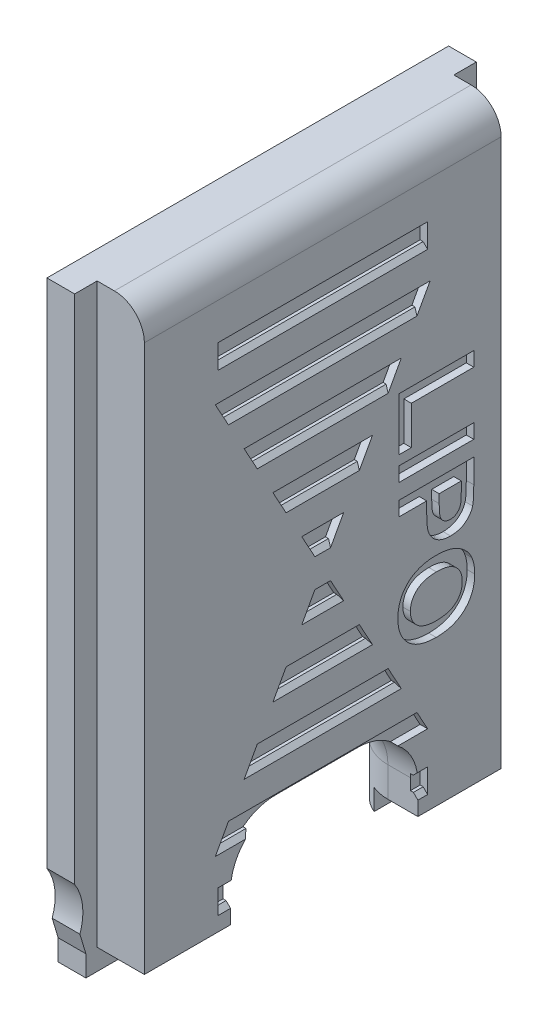
from build123d import *

# Parameters (mm, degrees)
BOSS_EXTRUDE1_DEPTH = 38.5
VARFILLET1_START    = -9.2125
VARFILLET1_DEPTH    = 26.8
CUT_EXTRUDE1_REACH  = 44.621
CUT_EXTRUDE2_REACH  = 44.444
SKETCH5_W           = 1.85
SKETCH5_H           = 6.5
SKETCH5_W_2         = 1.35
SKETCH5_H_2         = 6.3
BOSS_EXTRUDE3_DEPTH = 1.4
SKETCH3_W           = 14
SKETCH3_H           = 1
SKETCH3_W_2         = 5
SKETCH3_H_2         = 0.961538461
CUT_EXTRUDE3_DEPTH  = 0.5
CHAMFER1_SIZE       = 0.3
FILLET1_R           = 3


with BuildPart() as part:
    # Sketch1 → Boss-Extrude1 (new body)
    with BuildSketch(Plane(origin=(0, 0, 0), x_dir=(1, 0, 0), z_dir=(0, 1, 0))):
        Polygon((-3.75, -16.0875), (-3.75, -17.5875), (-5.6, -17.5875), (-5.6, 9.2125), (-3.75, 9.2125), (-3.75, 7.7125), (-0.6, 7.7125), (-0.6, -16.0875), align=None)
    extrude(amount=BOSS_EXTRUDE1_DEPTH)

    # VarFillet1: read off the stored shape, not the designer's step
    # VarFillet1 outline → VarFillet1 (cut)
    with BuildSketch(Plane.XY.offset(VARFILLET1_START)):
        with BuildLine():
            Line((-0.6, 38.5), (-2.6, 38.5))
            add(Edge.make_bspline(
                [(-2.6, 38.5), (-0.6, 38.5), (-0.6, 36.5)],
                knots=[0, 0, 0, 1, 1, 1], degree=2, weights=[1, 0.707106781, 1]))
            Line((-0.6, 36.5), (-0.6, 38.5))
        make_face()
    extrude(amount=VARFILLET1_DEPTH, mode=Mode.SUBTRACT)

    # Sketch2 → Cut-Extrude1 (cut, up to next)
    with BuildSketch(Plane(origin=(-0.6, 0, 0), x_dir=(0, 0, -1), z_dir=(1, 0, 0)), mode=Mode.PRIVATE) as cut_extrude1_sk1:
        with BuildLine():
            Line((-6.8375, 5.5), (-1.3375, 5.5))
            ThreePointArc((-1.3375, 5.5), (1.137373734, 4.474873734), (2.1625, 2))
            Line((2.1625, 2), (2.1625, 0))
            Line((2.1625, 0), (-10.3375, 0))
            Line((-10.3375, 0), (-10.3375, 2))
            ThreePointArc((-10.3375, 2), (-9.312373734, 4.474873734), (-6.8375, 5.5))
        make_face()
    cut_extrude1_tool1 = extrude(cut_extrude1_sk1.sketch, amount=-CUT_EXTRUDE1_REACH, mode=Mode.PRIVATE) & part.part
    add(cut_extrude1_tool1.solids().sort_by_distance((-0.6, 2.587014, 4.0875))[0], mode=Mode.SUBTRACT)

    # Sketch4 → Cut-Extrude2 (cut, up to next)
    with BuildSketch(Plane(origin=(-3.75, 0, 0), x_dir=(0, 0, -1), z_dir=(1, 0, 0)), mode=Mode.PRIVATE) as cut_extrude2_sk1:
        with BuildLine():
            Line((8.4625, 0), (8.8625, 0))
            Line((8.8625, 0), (9.2125, 0))
            Line((9.2125, 0), (9.2125, 4.38348082))
            ThreePointArc((9.2125, 4.38348082), (8.685324623, 2.899063146), (8.8625, 1.333809621))
            Line((8.8625, 1.333809621), (8.4625, 0))
        make_face()
    cut_extrude2_tool1 = extrude(cut_extrude2_sk1.sketch, amount=-CUT_EXTRUDE2_REACH, mode=Mode.PRIVATE) & part.part
    # Sketch4 → Cut-Extrude2 (cut, up to next)
    with BuildSketch(Plane(origin=(-3.75, 0, 0), x_dir=(0, 0, -1), z_dir=(1, 0, 0)), mode=Mode.PRIVATE) as cut_extrude2_sk2:
        with BuildLine():
            Line((-17.5875, 4.38348082), (-17.5875, 0))
            Line((-17.5875, 0), (-17.2375, 0))
            Line((-17.2375, 0), (-16.8375, 0))
            Line((-16.8375, 0), (-17.2375, 1.333809621))
            ThreePointArc((-17.2375, 1.333809621), (-17.060324623, 2.899063146), (-17.5875, 4.38348082))
        make_face()
    cut_extrude2_tool2 = extrude(cut_extrude2_sk2.sketch, amount=-CUT_EXTRUDE2_REACH, mode=Mode.PRIVATE) & part.part
    add(cut_extrude2_tool1.solids().sort_by_distance((-3.75, 1.895589, -8.960088))[0], mode=Mode.SUBTRACT)
    add(cut_extrude2_tool2.solids().sort_by_distance((-3.75, 1.895589, 17.335088))[0], mode=Mode.SUBTRACT)

    # Sketch5 → Boss-Extrude3 (add)
    with BuildSketch(Plane.XZ):
        with Locations((-4.675, 13.5875)):
            Rectangle(SKETCH5_W, SKETCH5_H)
        with Locations((-4.425, -5.3125)):
            Rectangle(SKETCH5_W_2, SKETCH5_H_2)
    extrude(amount=BOSS_EXTRUDE3_DEPTH)

    # Sketch3 → Cut-Extrude3 (cut)
    # profile 1 of 15: a face of its own
    with BuildSketch(Plane(origin=(-0.6, 0, 0), x_dir=(0, 0, -1), z_dir=(1, 0, 0))):
        with Locations((-4.1875, 33.25)):
            Rectangle(SKETCH3_W, SKETCH3_H)
    # profile 2 of 15: a face of its own
    with BuildSketch(Plane(origin=(-0.6, 0, 0), x_dir=(0, 0, -1), z_dir=(1, 0, 0))):
        Polygon((2.8125, 4.75), (2.263480392, 5.75), (-10.638480392, 5.75), (-11.1875, 4.75), align=None)
    # profile 3 of 15: a face of its own
    with BuildSketch(Plane(origin=(-0.6, 0, 0), x_dir=(0, 0, -1), z_dir=(1, 0, 0))):
        Polygon((-11.1875, 30.25), (2.8125, 30.25), (2.263480392, 29.25), (-10.638480392, 29.25), align=None)
    # profile 4 of 15: a face of its own
    with BuildSketch(Plane(origin=(-0.6, 0, 0), x_dir=(0, 0, -1), z_dir=(1, 0, 0))):
        Polygon((0.890931373, 26.75), (0.341911765, 25.75), (-8.716911765, 25.75), (-9.265931373, 26.75), align=None)
    # profile 5 of 15: a face of its own
    with BuildSketch(Plane(origin=(-0.6, 0, 0), x_dir=(0, 0, -1), z_dir=(1, 0, 0))):
        Polygon((-1.030637255, 23.25), (-1.579656863, 22.25), (-6.795343137, 22.25), (-7.344362745, 23.25), align=None)
    # profile 6 of 15: a face of its own
    with BuildSketch(Plane(origin=(-0.6, 0, 0), x_dir=(0, 0, -1), z_dir=(1, 0, 0))):
        Polygon((-2.952205882, 19.75), (-3.50122549, 18.75), (-4.87377451, 18.75), (-5.422794118, 19.75), align=None)
    # profile 7 of 15: a face of its own
    with BuildSketch(Plane(origin=(-0.6, 0, 0), x_dir=(0, 0, -1), z_dir=(1, 0, 0))):
        with BuildLine():
            Line((-10.328560011, 2.25), (-11.1875, 2.25))
            Line((-11.1875, 2.25), (-11.1875, 1.25))
            Line((-11.1875, 1.25), (-10.256198583, 1.25))
            ThreePointArc((-10.256198583, 1.25), (-10.328372521, 1.747395479), (-10.328560011, 2.25))
        make_face()
    # profile 8 of 15: a face of its own
    with BuildSketch(Plane(origin=(-0.6, 0, 0), x_dir=(0, 0, -1), z_dir=(1, 0, 0))):
        with BuildLine():
            Line((2.8125, 2.25), (2.153560011, 2.25))
            ThreePointArc((2.153560011, 2.25), (2.153372521, 1.747395479), (2.081198583, 1.25))
            Line((2.081198583, 1.25), (2.8125, 1.25))
            Line((2.8125, 1.25), (2.8125, 2.25))
        make_face()
    # profile 9 of 15: a face of its own
    with BuildSketch(Plane(origin=(-0.6, 0, 0), x_dir=(0, 0, -1), z_dir=(1, 0, 0))):
        Polygon((-4.87377451, 16.25), (-3.50122549, 16.25), (-2.952205882, 15.25), (-5.422794118, 15.25), align=None)
    # profile 10 of 15: a face of its own
    with BuildSketch(Plane(origin=(-0.6, 0, 0), x_dir=(0, 0, -1), z_dir=(1, 0, 0))):
        Polygon((-6.795343137, 12.75), (-7.344362745, 11.75), (-1.030637255, 11.75), (-1.579656863, 12.75), align=None)
    # profile 11 of 15: a face of its own
    with BuildSketch(Plane(origin=(-0.6, 0, 0), x_dir=(0, 0, -1), z_dir=(1, 0, 0))):
        Polygon((0.890931373, 8.25), (0.341911765, 9.25), (-8.716911765, 9.25), (-9.265931373, 8.25), align=None)
    # profile 12 of 15: a face of its own
    with BuildSketch(Plane(origin=(-0.6, 0, 0), x_dir=(0, 0, -1), z_dir=(1, 0, 0))):
        Polygon((0.890931373, 25.064102564), (5.890931373, 25.064102564), (5.890931373, 24.102564103), (1.724264706, 24.102564103), (1.724264706, 21.538461538), (0.890931373, 21.538461538), align=None)
    # profile 13 of 15: a face of its own
    with BuildSketch(Plane(origin=(-0.6, 0, 0), x_dir=(0, 0, -1), z_dir=(1, 0, 0))):
        with Locations((3.390931373, 20.416666666)):
            Rectangle(SKETCH3_W_2, SKETCH3_H_2)
    # profile 14 of 15: a face of its own
    with BuildSketch(Plane(origin=(-0.6, 0, 0), x_dir=(0, 0, -1), z_dir=(1, 0, 0))):
        with BuildLine():
            Line((0.890931373, 18.91025641), (5.890931373, 18.91025641))
            Line((5.890931373, 18.91025641), (5.890931373, 17.310697115))
            add(Edge.make_bspline(
                [(5.890931373, 17.310697115), (5.890857374, 17.23824535), (5.890716182, 17.100006544), (5.88645526, 16.902343386), (5.880578691, 16.724372351), (5.873104496, 16.566037089), (5.862172056, 16.427754746), (5.84907865, 16.309217858), (5.835597417, 16.209881795), (5.821233915, 16.151093716), (5.814809578, 16.124799679)],
                knots=[0, 0, 0, 0, 1.460492613, 2.786636817, 3.985312262, 5.05006335, 5.98179196, 6.7807735, 7.454678796, 8, 8, 8, 8], degree=3))
            add(Edge.make_bspline(
                [(5.814809578, 16.124799679), (5.804839194, 16.089832874), (5.785050319, 16.020431958), (5.742863579, 15.921002091), (5.693971402, 15.825167429), (5.635700747, 15.7341321), (5.569086206, 15.647586394), (5.494670718, 15.565274019), (5.412119553, 15.486752296), (5.321591138, 15.4131219), (5.223559827, 15.345641786), (5.11781254, 15.287485082), (5.005168385, 15.238182701), (4.885298018, 15.19856066), (4.758986077, 15.16580116), (4.625104168, 15.144888197), (4.484693414, 15.129770595), (4.388571549, 15.128734579), (4.339449001, 15.128205128)],
                knots=[0, 0, 0, 0, 0.907183394, 1.800546498, 2.691728384, 3.591410291, 4.495216108, 5.416087871, 6.359626967, 7.337496937, 8.327236581, 9.327316132, 10.346534403, 11.393207653, 12.477041209, 13.600953845, 14.773980723, 16, 16, 16, 16], degree=3))
            add(Edge.make_bspline(
                [(4.339449001, 15.128205128), (4.264855043, 15.129747669), (4.121257577, 15.132717144), (3.915402059, 15.165964391), (3.727334393, 15.216628915), (3.559010123, 15.290833688), (3.409096925, 15.38089912), (3.275472886, 15.481738148), (3.158468198, 15.594154303), (3.059876425, 15.717050467), (2.978761373, 15.846707092), (2.909694188, 15.976699781), (2.856574025, 16.108655653), (2.833431775, 16.198626975), (2.822021116, 16.242988782)],
                knots=[0, 0, 0, 0, 1.312446177, 2.526530956, 3.662051072, 4.733637382, 5.754065268, 6.735959421, 7.675686778, 8.604015004, 9.502732733, 10.365317746, 11.193993632, 12, 12, 12, 12], degree=3))
            add(Edge.make_bspline(
                [(2.822021116, 16.242988782), (2.815998059, 16.274651835), (2.803302174, 16.341393772), (2.790646688, 16.447242493), (2.776638444, 16.56294088), (2.76750148, 16.688964811), (2.758945097, 16.825161828), (2.754905345, 16.971479047), (2.750038266, 17.127707363), (2.74995081, 17.235238233), (2.749905732, 17.290665064)],
                knots=[0, 0, 0, 0, 0.735353946, 1.55003838, 2.431865514, 3.394945452, 4.432993119, 5.54609699, 6.735134699, 8, 8, 8, 8], degree=3))
            Line((2.749905732, 17.290665064), (2.749905732, 17.948717949))
            Line((2.749905732, 17.948717949), (0.890931373, 17.948717949))
            Line((0.890931373, 17.948717949), (0.890931373, 18.91025641))
        make_face()
        with BuildLine():
            Line((5.057598039, 17.948717949), (3.583239065, 17.948717949))
            Line((3.583239065, 17.948717949), (3.583239065, 17.371794872))
            add(Edge.make_bspline(
                [(3.583239065, 17.371794872), (3.583303488, 17.322044242), (3.583426737, 17.226865027), (3.587850655, 17.090303967), (3.593250867, 16.966688766), (3.602189323, 16.855761134), (3.613969995, 16.758190661), (3.628061162, 16.67332394), (3.643182457, 16.601062061), (3.668240865, 16.522920676), (3.708783084, 16.439371913), (3.767052437, 16.350151653), (3.83672032, 16.27177176), (3.918542836, 16.206549299), (4.009452392, 16.154450994), (4.108517316, 16.11714857), (4.214095758, 16.093062429), (4.287232681, 16.09086238), (4.324424962, 16.08974359)],
                knots=[0, 0, 0, 0, 1.411705958, 2.700771114, 3.876961699, 4.922619712, 5.858038221, 6.66485904, 7.363650596, 7.950905807, 8.989198271, 9.987739806, 10.967313358, 11.951275539, 12.944273208, 13.927870418, 14.946261014, 16, 16, 16, 16], degree=3))
            add(Edge.make_bspline(
                [(4.324424962, 16.08974359), (4.369724581, 16.091318164), (4.457554568, 16.094371056), (4.582639128, 16.128035929), (4.696154882, 16.179976981), (4.794569844, 16.254237939), (4.877328733, 16.343943429), (4.946187072, 16.444768655), (4.994374661, 16.558866787), (5.013045573, 16.639617682), (5.022541949, 16.680689103)],
                knots=[0, 0, 0, 0, 1.085904563, 2.105425768, 3.088705091, 4.068969419, 5.045188284, 6.010769642, 6.988240112, 8, 8, 8, 8], degree=3))
            add(Edge.make_bspline(
                [(5.022541949, 16.680689103), (5.025368757, 16.698363073), (5.031643393, 16.737593808), (5.038191756, 16.802803273), (5.044147486, 16.879946081), (5.049037318, 16.969115219), (5.052860035, 17.069957244), (5.056209677, 17.182804777), (5.056478776, 17.307360614), (5.057214615, 17.394498679), (5.057598039, 17.439903846)],
                knots=[0, 0, 0, 0, 0.564603001, 1.253243608, 2.066786758, 3.005752288, 4.070476343, 5.250658742, 6.567396469, 8, 8, 8, 8], degree=3))
            Line((5.057598039, 17.439903846), (5.057598039, 17.948717949))
        make_face(mode=Mode.SUBTRACT)
    # profile 15 of 15: a face of its own
    with BuildSketch(Plane(origin=(-0.6, 0, 0), x_dir=(0, 0, -1), z_dir=(1, 0, 0))):
        with BuildLine():
            add(Edge.make_bspline(
                [(3.360883296, 14.487179487), (3.422671232, 14.486825658), (3.544014764, 14.486130782), (3.72203028, 14.4740902), (3.892664799, 14.458219776), (4.055247152, 14.432374814), (4.210538281, 14.401971704), (4.358492089, 14.363945483), (4.498589708, 14.318137351), (4.588040523, 14.28169662), (4.631916949, 14.263822115)],
                knots=[0, 0, 0, 0, 1.141009212, 2.240794809, 3.294380675, 4.305229195, 5.280013876, 6.216333343, 7.125095522, 8, 8, 8, 8], degree=3))
            add(Edge.make_bspline(
                [(4.631916949, 14.263822115), (4.694292372, 14.234604083), (4.81830958, 14.17651167), (4.993555864, 14.068624929), (5.15882731, 13.946341669), (5.313257495, 13.810668616), (5.454521561, 13.665069543), (5.575423262, 13.508857584), (5.680045703, 13.34758248), (5.732664573, 13.232879267), (5.758719834, 13.176081731)],
                knots=[0, 0, 0, 0, 1.031372299, 2.050613973, 3.077158538, 4.108712802, 5.127684358, 6.111366908, 7.06480644, 8, 8, 8, 8], degree=3))
            add(Edge.make_bspline(
                [(5.758719834, 13.176081731), (5.774533806, 13.137527776), (5.806497875, 13.059600403), (5.846390709, 12.938492094), (5.878801833, 12.812788592), (5.907773602, 12.683399104), (5.92775059, 12.549067366), (5.944500607, 12.410878834), (5.953279583, 12.26807725), (5.954442792, 12.171484447), (5.955033937, 12.122395833)],
                knots=[0, 0, 0, 0, 0.92659354, 1.872881803, 2.832850937, 3.813025581, 4.820167273, 5.851730198, 6.908245912, 8, 8, 8, 8], degree=3))
            add(Edge.make_bspline(
                [(5.955033937, 12.122395833), (5.95283065, 12.034498865), (5.948518789, 11.862483291), (5.917374669, 11.611216897), (5.864785107, 11.373442391), (5.788773175, 11.149965598), (5.693758428, 10.938856323), (5.575896778, 10.741767372), (5.436493893, 10.558359964), (5.277347926, 10.389166219), (5.099309039, 10.236394841), (4.902177818, 10.105186802), (4.690195433, 9.992095457), (4.460618967, 9.900892909), (4.214744573, 9.829757713), (3.952022601, 9.78096152), (3.673524465, 9.74854077), (3.482174015, 9.745269475), (3.383920155, 9.743589744)],
                knots=[0, 0, 0, 0, 1.064687426, 2.083607927, 3.061933343, 4.009715682, 4.938290439, 5.861555806, 6.785379163, 7.723907601, 8.670645075, 9.620815051, 10.587025556, 11.576201955, 12.607926824, 13.682791464, 14.810169074, 16, 16, 16, 16], degree=3))
            add(Edge.make_bspline(
                [(3.383920155, 9.743589744), (3.286344519, 9.745383616), (3.096382987, 9.74887595), (2.819763469, 9.779698306), (2.559318604, 9.828518994), (2.315641288, 9.900717542), (2.086879373, 9.98972226), (1.875731699, 10.102245981), (1.67949175, 10.232311042), (1.502566398, 10.384516925), (1.343222832, 10.551936908), (1.205408856, 10.734938709), (1.086870437, 10.929964118), (0.991649038, 11.140023089), (0.917558827, 11.363348448), (0.864465237, 11.599830025), (0.833313761, 11.849794952), (0.829024796, 12.020811453), (0.826828808, 12.108373397)],
                knots=[0, 0, 0, 0, 1.188503542, 2.313794348, 3.386815875, 4.412724616, 5.406050757, 6.372287373, 7.322246111, 8.268662201, 9.209598637, 10.133005659, 11.054574072, 11.984756797, 12.936664457, 13.916615443, 14.933288873, 16, 16, 16, 16], degree=3))
            add(Edge.make_bspline(
                [(0.826828808, 12.108373397), (0.829049595, 12.196932717), (0.833396311, 12.370268746), (0.86426679, 12.623269115), (0.917558786, 12.862386006), (0.991561143, 13.087272536), (1.08618235, 13.298832813), (1.202646145, 13.495843261), (1.341362021, 13.678431758), (1.499452559, 13.846284224), (1.675464921, 13.998443391), (1.870499569, 14.128268191), (2.079569423, 14.240813048), (2.305839739, 14.330281434), (2.546982938, 14.402083601), (2.804386449, 14.451023244), (3.077341867, 14.481905297), (3.264641959, 14.48538929), (3.360883296, 14.487179487)],
                knots=[0, 0, 0, 0, 1.080868081, 2.11556935, 3.105256676, 4.066632898, 5.000538419, 5.928691231, 6.853779256, 7.79363201, 8.738674366, 9.686979733, 10.647777075, 11.631556772, 12.651514868, 13.714488213, 14.825624133, 16, 16, 16, 16], degree=3))
        make_face()
        with BuildLine():
            add(Edge.make_bspline(
                [(3.39393618, 13.525641026), (3.32477263, 13.524681164), (3.190838732, 13.522822411), (2.996442497, 13.503000163), (2.814688828, 13.472966164), (2.64587643, 13.428632835), (2.489426943, 13.373119649), (2.346474486, 13.303201185), (2.215068897, 13.222754062), (2.099200791, 13.127523721), (1.99562794, 13.024667424), (1.906459264, 12.913652214), (1.828740136, 12.79721155), (1.76822964, 12.671994749), (1.71987416, 12.541187609), (1.684081121, 12.403792185), (1.664413737, 12.259188575), (1.661594542, 12.160512681), (1.660162142, 12.110376603)],
                knots=[0, 0, 0, 0, 1.313760844, 2.544072881, 3.709057706, 4.810798106, 5.856328071, 6.8578978, 7.829608234, 8.776800457, 9.700893773, 10.598542645, 11.478326183, 12.355016441, 13.234159304, 14.125057487, 15.047363429, 16, 16, 16, 16], degree=3))
            add(Edge.make_bspline(
                [(1.660162142, 12.110376603), (1.661565829, 12.060233975), (1.664328513, 11.961545193), (1.684393429, 11.817116333), (1.718667963, 11.679459289), (1.766716072, 11.549133023), (1.828537943, 11.425543295), (1.903891649, 11.308798625), (1.993854547, 11.199568626), (2.09585657, 11.096770343), (2.212545808, 11.004180832), (2.343665016, 10.924252176), (2.487775181, 10.855402623), (2.646121225, 10.801492877), (2.816890096, 10.756293485), (3.002247759, 10.728044351), (3.200516094, 10.707896839), (3.337455529, 10.706069175), (3.407958616, 10.705128205)],
                knots=[0, 0, 0, 0, 0.949185128, 1.868149516, 2.754265681, 3.630223372, 4.492411659, 5.365559627, 6.255051142, 7.166857153, 8.10270998, 9.067572068, 10.068471475, 11.120005306, 12.229988237, 13.408413857, 14.665725295, 16, 16, 16, 16], degree=3))
            add(Edge.make_bspline(
                [(3.407958616, 10.705128205), (3.477777104, 10.706206242), (3.612987239, 10.708293963), (3.808805018, 10.726453386), (3.990963164, 10.756246114), (4.159505545, 10.79749523), (4.314015323, 10.852520681), (4.456134604, 10.916339013), (4.583486441, 10.99556291), (4.697023258, 11.086080138), (4.797463483, 11.186262226), (4.883863817, 11.295213787), (4.958060739, 11.41137409), (5.018081843, 11.535800059), (5.064547246, 11.668568067), (5.0970731, 11.808966594), (5.117721356, 11.957191351), (5.120354512, 12.058557429), (5.121700603, 12.110376603)],
                knots=[0, 0, 0, 0, 1.332102096, 2.579742291, 3.748638211, 4.851919079, 5.885623862, 6.874802917, 7.818925756, 8.739297243, 9.640302518, 10.519879355, 11.387702267, 12.265338757, 13.149908458, 14.066302139, 15.011477716, 16, 16, 16, 16], degree=3))
            add(Edge.make_bspline(
                [(5.121700603, 12.110376603), (5.120357699, 12.16219668), (5.117730778, 12.263564523), (5.097037782, 12.411776605), (5.064577687, 12.552636728), (5.017271814, 12.685761773), (4.955767944, 12.810594091), (4.880879641, 12.927563282), (4.793453843, 13.037510951), (4.691984652, 13.138611925), (4.577409681, 13.230625603), (4.448233885, 13.309616376), (4.305861017, 13.376972732), (4.149871618, 13.432234893), (3.979836006, 13.473201196), (3.796897087, 13.504687223), (3.59994756, 13.522368605), (3.464082552, 13.524526774), (3.39393618, 13.525641026)],
                knots=[0, 0, 0, 0, 0.981979984, 1.920900141, 2.831228887, 3.718021039, 4.592624278, 5.463440991, 6.346090553, 7.250083161, 8.173257457, 9.125226447, 10.113224917, 11.154132427, 12.2562525, 13.424702564, 14.670387795, 16, 16, 16, 16], degree=3))
        make_face(mode=Mode.SUBTRACT)
    extrude(amount=-CUT_EXTRUDE3_DEPTH, mode=Mode.SUBTRACT)

    # Chamfer1
    chamfer1_edges = [part.edges().sort_by_distance(p)[0] for p in [
        (-0.6, 32.75, 4.1875),
        (-0.6, 33.75, 4.1875),
        (-0.6, 4.75, 10.095031755),
        (-0.6, 5.75, 4.1875),
        (-0.6, 8.25, 4.1875),
        (-0.6, 9.25, 4.1875),
        (-0.6, 29.25, 4.1875),
        (-0.6, 30.25, 4.1875),
        (-0.6, 1.25, -2.4875),
        (-0.6, 2.25, -2.483030005),
        (-0.6, 19.75, 4.1875),
        (-0.6, 18.75, 4.1875),
        (-0.6, 23.25, 4.1875),
        (-0.6, 22.25, 4.1875),
        (-0.6, 1.25, 10.7625),
        (-0.6, 2.25, 10.758030005),
        (-0.6, 25.75, 4.1875),
        (-0.6, 26.75, 4.1875),
        (-0.6, 16.25, 4.1875),
        (-0.6, 15.25, 4.1875),
        (-0.6, 11.75, 4.1875),
        (-0.6, 12.75, 4.1875),
    ]]
    chamfer(chamfer1_edges, length=CHAMFER1_SIZE)

    # Fillet1
    fillet1_edges = [part.edges().sort_by_distance(p)[0] for p in [
        (-5.6, 0.3, 10.3375),
        (-5.6, 4.474873734, 9.312373734),
        (-5.6, 5.5, 4.0875),
        (-5.6, 1, -2.1625),
        (-5.6, 4.474873734, -1.137373734),
    ]]
    fillet(fillet1_edges, radius=FILLET1_R)


solid = part.part
